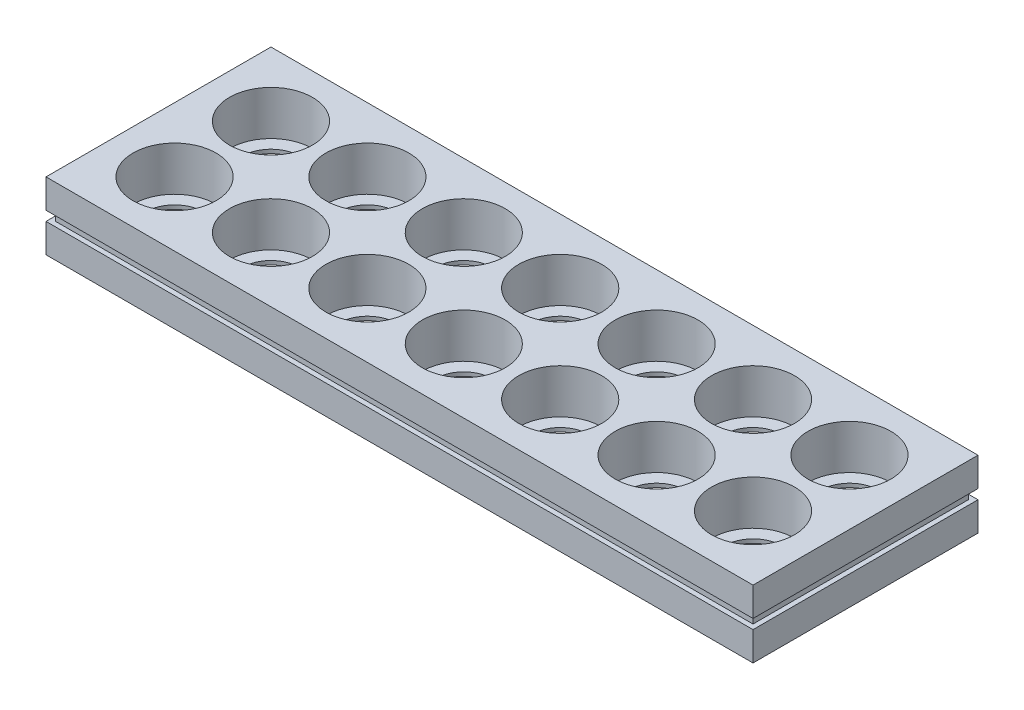
from build123d import *

# Parameters (mm, degrees)
SKETCH1_W           = 186.266666666
SKETCH1_H           = 59.266666666
SKETCH1_R           = 10.922
BOSS_EXTRUDE2_DEPTH = 12.7
SKETCH1_4_R         = 10.922
SKETCH1_4_R_2       = 7.5
BOSS_EXTRUDE3_DEPTH = 1.016
SKETCH1_6_W         = 186.266666666
SKETCH1_6_H         = 59.266666666
SKETCH1_6_W_2       = 181.186666666
SKETCH1_6_H_2       = 54.186666666
BOSS_EXTRUDE4_DEPTH = 5.08
SKETCH2_W           = 186.266666666
SKETCH2_H           = 2.54
CUT_EXTRUDE1_DEPTH  = 1.27
SKETCH6_W           = 59.266666666
SKETCH6_H           = 2.54
CUT_EXTRUDE5_DEPTH  = 1.27
SKETCH7_W           = 186.266666666
SKETCH7_H           = 2.54
CUT_EXTRUDE6_DEPTH  = 1.27
SKETCH8_W           = 59.266666666
SKETCH8_H           = 2.54
CUT_EXTRUDE7_DEPTH  = 1.27


with BuildPart() as part:
    # Sketch1 → Boss-Extrude2 (new body)
    with BuildSketch(Plane(origin=(0, 0, 0), x_dir=(1, 0, 0), z_dir=(0, 1, 0))):
        with Locations((76.2, 12.7)):
            Rectangle(SKETCH1_W, SKETCH1_H)
        with Locations((76.2, 25.4)):
            Circle(SKETCH1_R, mode=Mode.SUBTRACT)
        with Locations((101.6, 25.4)):
            Circle(SKETCH1_R, mode=Mode.SUBTRACT)
        with Locations((127, 25.4)):
            Circle(SKETCH1_R, mode=Mode.SUBTRACT)
        with Locations((152.4, 25.4)):
            Circle(SKETCH1_R, mode=Mode.SUBTRACT)
        Circle(SKETCH1_R, mode=Mode.SUBTRACT)
        with Locations((25.4, 0)):
            Circle(SKETCH1_R, mode=Mode.SUBTRACT)
        with Locations((50.8, 0)):
            Circle(SKETCH1_R, mode=Mode.SUBTRACT)
        with Locations((76.2, 0)):
            Circle(SKETCH1_R, mode=Mode.SUBTRACT)
        with Locations((101.6, 0)):
            Circle(SKETCH1_R, mode=Mode.SUBTRACT)
        with Locations((127, 0)):
            Circle(SKETCH1_R, mode=Mode.SUBTRACT)
        with Locations((152.4, 0)):
            Circle(SKETCH1_R, mode=Mode.SUBTRACT)
        with Locations((0, 25.4)):
            Circle(SKETCH1_R, mode=Mode.SUBTRACT)
        with Locations((25.4, 25.4)):
            Circle(SKETCH1_R, mode=Mode.SUBTRACT)
        with Locations((50.8, 25.4)):
            Circle(SKETCH1_R, mode=Mode.SUBTRACT)
    extrude(amount=BOSS_EXTRUDE2_DEPTH)

    # Sketch1<4> → Boss-Extrude3 (add)
    # profile 1 of 14: a face of its own
    with BuildSketch(Plane(origin=(0, 0, 0), x_dir=(1, 0, 0), z_dir=(0, 1, 0))):
        Circle(SKETCH1_4_R)
        Circle(SKETCH1_4_R_2, mode=Mode.SUBTRACT)
    # profile 2 of 14: a face of its own
    with BuildSketch(Plane(origin=(0, 0, 0), x_dir=(1, 0, 0), z_dir=(0, 1, 0))):
        with Locations((25.4, 0)):
            Circle(SKETCH1_4_R)
        with Locations((25.4, 0)):
            Circle(SKETCH1_4_R_2, mode=Mode.SUBTRACT)
    # profile 3 of 14: a face of its own
    with BuildSketch(Plane(origin=(0, 0, 0), x_dir=(1, 0, 0), z_dir=(0, 1, 0))):
        with Locations((50.8, 0)):
            Circle(SKETCH1_4_R)
        with Locations((50.8, 0)):
            Circle(SKETCH1_4_R_2, mode=Mode.SUBTRACT)
    # profile 4 of 14: a face of its own
    with BuildSketch(Plane(origin=(0, 0, 0), x_dir=(1, 0, 0), z_dir=(0, 1, 0))):
        with Locations((76.2, 0)):
            Circle(SKETCH1_4_R)
        with Locations((76.2, 0)):
            Circle(SKETCH1_4_R_2, mode=Mode.SUBTRACT)
    # profile 5 of 14: a face of its own
    with BuildSketch(Plane(origin=(0, 0, 0), x_dir=(1, 0, 0), z_dir=(0, 1, 0))):
        with Locations((101.6, 0)):
            Circle(SKETCH1_4_R)
        with Locations((101.6, 0)):
            Circle(SKETCH1_4_R_2, mode=Mode.SUBTRACT)
    # profile 6 of 14: a face of its own
    with BuildSketch(Plane(origin=(0, 0, 0), x_dir=(1, 0, 0), z_dir=(0, 1, 0))):
        with Locations((127, 0)):
            Circle(SKETCH1_4_R)
        with Locations((127, 0)):
            Circle(SKETCH1_4_R_2, mode=Mode.SUBTRACT)
    # profile 7 of 14: a face of its own
    with BuildSketch(Plane(origin=(0, 0, 0), x_dir=(1, 0, 0), z_dir=(0, 1, 0))):
        with Locations((152.4, 0)):
            Circle(SKETCH1_4_R)
        with Locations((152.4, 0)):
            Circle(SKETCH1_4_R_2, mode=Mode.SUBTRACT)
    # profile 8 of 14: a face of its own
    with BuildSketch(Plane(origin=(0, 0, 0), x_dir=(1, 0, 0), z_dir=(0, 1, 0))):
        with Locations((25.4, 25.4)):
            Circle(SKETCH1_4_R)
        with Locations((25.4, 25.4)):
            Circle(SKETCH1_4_R_2, mode=Mode.SUBTRACT)
    # profile 9 of 14: a face of its own
    with BuildSketch(Plane(origin=(0, 0, 0), x_dir=(1, 0, 0), z_dir=(0, 1, 0))):
        with Locations((50.8, 25.4)):
            Circle(SKETCH1_4_R)
        with Locations((50.8, 25.4)):
            Circle(SKETCH1_4_R_2, mode=Mode.SUBTRACT)
    # profile 10 of 14: a face of its own
    with BuildSketch(Plane(origin=(0, 0, 0), x_dir=(1, 0, 0), z_dir=(0, 1, 0))):
        with Locations((76.2, 25.4)):
            Circle(SKETCH1_4_R)
        with Locations((76.2, 25.4)):
            Circle(SKETCH1_4_R_2, mode=Mode.SUBTRACT)
    # profile 11 of 14: a face of its own
    with BuildSketch(Plane(origin=(0, 0, 0), x_dir=(1, 0, 0), z_dir=(0, 1, 0))):
        with Locations((101.6, 25.4)):
            Circle(SKETCH1_4_R)
        with Locations((101.6, 25.4)):
            Circle(SKETCH1_4_R_2, mode=Mode.SUBTRACT)
    # profile 12 of 14: a face of its own
    with BuildSketch(Plane(origin=(0, 0, 0), x_dir=(1, 0, 0), z_dir=(0, 1, 0))):
        with Locations((127, 25.4)):
            Circle(SKETCH1_4_R)
        with Locations((127, 25.4)):
            Circle(SKETCH1_4_R_2, mode=Mode.SUBTRACT)
    # profile 13 of 14: a face of its own
    with BuildSketch(Plane(origin=(0, 0, 0), x_dir=(1, 0, 0), z_dir=(0, 1, 0))):
        with Locations((152.4, 25.4)):
            Circle(SKETCH1_4_R)
        with Locations((152.4, 25.4)):
            Circle(SKETCH1_4_R_2, mode=Mode.SUBTRACT)
    # profile 14 of 14: a face of its own
    with BuildSketch(Plane(origin=(0, 0, 0), x_dir=(1, 0, 0), z_dir=(0, 1, 0))):
        with Locations((0, 25.4)):
            Circle(SKETCH1_4_R)
        with Locations((0, 25.4)):
            Circle(SKETCH1_4_R_2, mode=Mode.SUBTRACT)
    extrude(amount=BOSS_EXTRUDE3_DEPTH)

    # Sketch1<6> → Boss-Extrude4 (add)
    with BuildSketch(Plane(origin=(0, 0, 0), x_dir=(1, 0, 0), z_dir=(0, 1, 0))):
        with Locations((76.2, 12.7)):
            Rectangle(SKETCH1_6_W, SKETCH1_6_H)
        with Locations((76.2, 12.7)):
            Rectangle(SKETCH1_6_W_2, SKETCH1_6_H_2, mode=Mode.SUBTRACT)
    extrude(amount=-BOSS_EXTRUDE4_DEPTH)

    # Sketch2 → Cut-Extrude1 (cut)
    with BuildSketch(Plane.XY.offset(16.933333333)):
        with Locations((76.2, 3.81)):
            Rectangle(SKETCH2_W, SKETCH2_H)
    extrude(amount=-CUT_EXTRUDE1_DEPTH, mode=Mode.SUBTRACT)

    # Sketch6 → Cut-Extrude5 (cut)
    with BuildSketch(Plane(origin=(169.333333333, 0, 0), x_dir=(0, 0, -1), z_dir=(1, 0, 0))):
        with Locations((12.7, 3.81)):
            Rectangle(SKETCH6_W, SKETCH6_H)
    extrude(amount=-CUT_EXTRUDE5_DEPTH, mode=Mode.SUBTRACT)

    # Sketch7 → Cut-Extrude6 (cut)
    with BuildSketch(Plane(origin=(0, 0, -42.333333333), x_dir=(-1, 0, 0), z_dir=(0, 0, -1))):
        with Locations((-76.2, 3.81)):
            Rectangle(SKETCH7_W, SKETCH7_H)
    extrude(amount=-CUT_EXTRUDE6_DEPTH, mode=Mode.SUBTRACT)

    # Sketch8 → Cut-Extrude7 (cut)
    with BuildSketch(Plane.ZY.offset(16.933333333)):
        with Locations((-12.7, 3.81)):
            Rectangle(SKETCH8_W, SKETCH8_H)
    extrude(amount=-CUT_EXTRUDE7_DEPTH, mode=Mode.SUBTRACT)


solid = part.part
